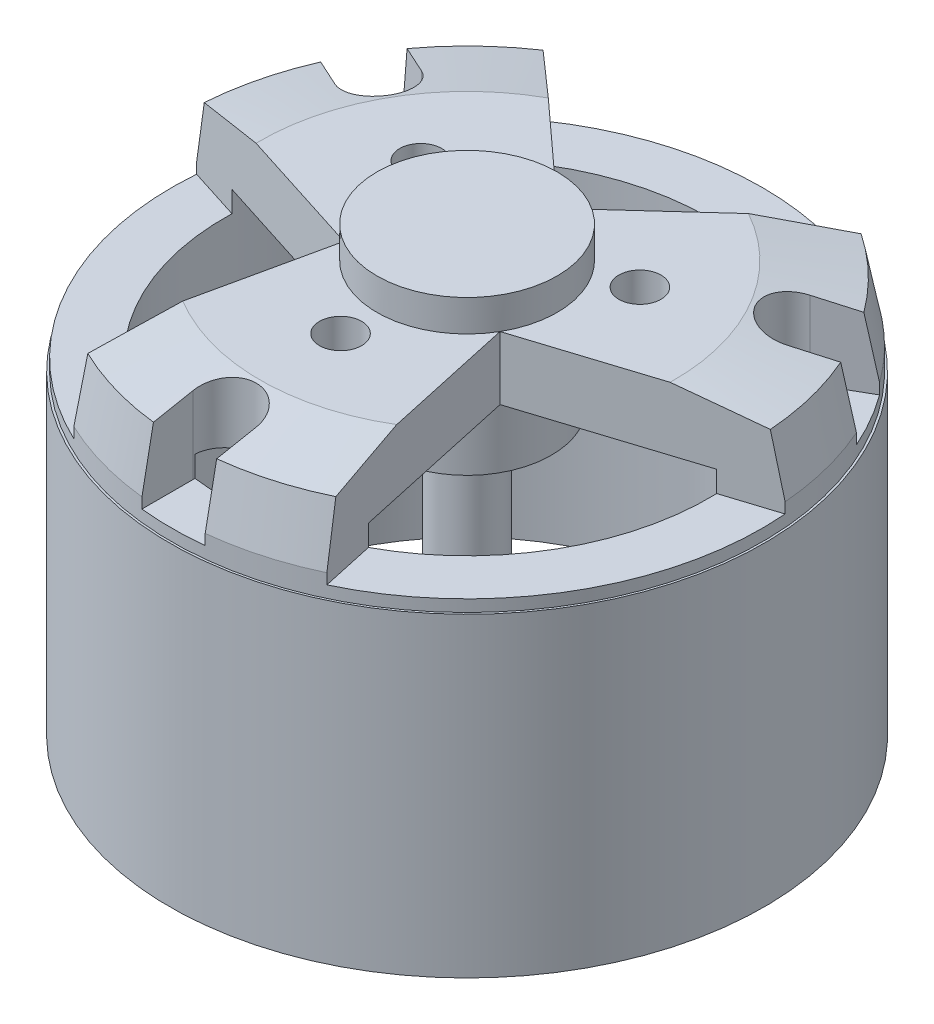
from build123d import *

# Parameters (mm, degrees)
SCHIZZO1_R                   = 14
ESTRUSIONE_ESTRUSIONE1_DEPTH = 19.5
TAGLIO_ESTRUSIONE1_START     = -4
SCHIZZO2_R                   = 1
TAGLIO_ESTRUSIONE1_DEPTH     = 4
SCHIZZO3_R                   = 4.27486225
ESTRUSIONE_ESTRUSIONE2_DEPTH = 1.5
SCHIZZO4_R                   = 11.5
TAGLIO_ESTRUSIONE2_DEPTH     = 16.5
SCHIZZO5_R                   = 1.5
TAGLIO_ESTRUSIONE3_DEPTH     = 16.5
TAGLIO_ESTRUSIONE4_START     = -4
TAGLIO_ESTRUSIONE4_DEPTH     = 4
SCHIZZO7_R                   = 1.5
ESTRUSIONE_ESTRUSIONE3_DEPTH = 27.5
SCHIZZO8_R                   = 4
ESTRUSIONE_ESTRUSIONE4_DEPTH = 3
SCHIZZO9_W                   = 0.1
SCHIZZO9_H                   = 14.938811625
SMUSSO1_SIZE                 = 3.5
SMUSSO1_SIZE2                = 0.680331082
SMUSSO2_SIZE                 = 0.720279458
SMUSSO2_SIZE_2               = 3.5


with BuildPart() as part:
    # Schizzo1 → Estrusione-Estrusione1 (new body)
    with BuildSketch(Plane(origin=(0, 0, 0), x_dir=(1, 0, 0), z_dir=(0, 1, 0))):
        with Locations(Location((0, 0, 0), (0, 0, 270))):
            Circle(SCHIZZO1_R)
    extrude(amount=ESTRUSIONE_ESTRUSIONE1_DEPTH)

    # Schizzo2 → Taglio-Estrusione1 (cut)
    with BuildSketch(Plane(origin=(0, 19.5, 0), x_dir=(1, 0, 0), z_dir=(0, 1, 0)).offset(TAGLIO_ESTRUSIONE1_START)):
        with BuildLine():
            Line((-7.95445115, 11.520707743), (0, 4.27486225))
            Line((0, 4.27486225), (7.95445115, 11.520707743))
            ThreePointArc((7.95445115, 11.520707743), (0, 14), (-7.95445115, 11.520707743))
        make_face()
        with BuildLine():
            ThreePointArc((14, 0), (13.988608153, 0.564660915), (13.95445115, 1.128402898))
            Line((13.95445115, 1.128402898), (3.702139306, -2.137431125))
            Line((3.702139306, -2.137431125), (6, -12.649110641))
            ThreePointArc((6, -12.649110641), (11.832159566, -7.483314774), (14, 0))
        make_face()
        with BuildLine():
            Line((-3.702139306, -2.137431125), (-13.95445115, 1.128402898))
            ThreePointArc((-13.95445115, 1.128402898), (-12.124355653, -7), (-6, -12.649110641))
            Line((-6, -12.649110641), (-3.702139306, -2.137431125))
        make_face()
        with Locations(Location((0, -6, 0), (0, 0, 270))):
            Circle(SCHIZZO2_R)
        with Locations(Location((-5.196152423, 3, 0), (0, 0, 270))):
            Circle(SCHIZZO2_R)
        with Locations(Location((5.196152423, 3, 0), (0, 0, 270))):
            Circle(SCHIZZO2_R)
    extrude(amount=TAGLIO_ESTRUSIONE1_DEPTH, mode=Mode.SUBTRACT)

    # Schizzo3 → Estrusione-Estrusione2 (add)
    with BuildSketch(Plane(origin=(0, 19.5, 0), x_dir=(1, 0, 0), z_dir=(0, 1, 0))):
        with Locations(Location((0, 0, 0), (0, 0, 90))):
            Circle(SCHIZZO3_R)
    extrude(amount=ESTRUSIONE_ESTRUSIONE2_DEPTH)

    # Schizzo4 → Taglio-Estrusione2 (cut)
    with BuildSketch(Plane.XZ):
        with Locations(Location((0, 0, 0), (0, 0, 270))):
            Circle(SCHIZZO4_R)
    extrude(amount=-TAGLIO_ESTRUSIONE2_DEPTH, mode=Mode.SUBTRACT)

    # Schizzo5 → Taglio-Estrusione3 (cut)
    with BuildSketch(Plane(origin=(0, 21, 0), x_dir=(1, 0, 0), z_dir=(0, 1, 0))):
        with Locations(Location((0, 0, 0), (0, 0, 270))):
            Circle(SCHIZZO5_R)
    extrude(amount=-TAGLIO_ESTRUSIONE3_DEPTH, mode=Mode.SUBTRACT)

    # Schizzo6 → Taglio-Estrusione4 (cut)
    with BuildSketch(Plane(origin=(0, 19.5, 0), x_dir=(1, 0, 0), z_dir=(0, 1, 0)).offset(TAGLIO_ESTRUSIONE4_START)):
        with BuildLine():
            Line((1.5, -13.919410907), (1.5, -11.5))
            ThreePointArc((1.5, -11.5), (0, -10), (-1.5, -11.5))
            Line((-1.5, -11.5), (-1.5, -13.919410907))
            ThreePointArc((-1.5, -13.919410907), (0, -14), (1.5, -13.919410907))
        make_face()
        with BuildLine():
            ThreePointArc((9.209292144, 7.049038106), (8.660254038, 5), (10.709292144, 4.450961894))
            Line((10.709292144, 4.450961894), (12.804563451, 5.660667348))
            ThreePointArc((12.804563451, 5.660667348), (12.124355653, 7), (11.304563451, 8.258743559))
            Line((11.304563451, 8.258743559), (9.209292144, 7.049038106))
        make_face()
        with BuildLine():
            ThreePointArc((-10.709292144, 4.450961894), (-8.660254038, 5), (-9.209292144, 7.049038106))
            Line((-9.209292144, 7.049038106), (-11.304563451, 8.258743559))
            ThreePointArc((-11.304563451, 8.258743559), (-12.124355653, 7), (-12.804563451, 5.660667348))
            Line((-12.804563451, 5.660667348), (-10.709292144, 4.450961894))
        make_face()
    extrude(amount=TAGLIO_ESTRUSIONE4_DEPTH, mode=Mode.SUBTRACT)

    # Schizzo7 → Estrusione-Estrusione3 (add)
    with BuildSketch(Plane(origin=(0, 21, 0), x_dir=(1, 0, 0), z_dir=(0, 1, 0))):
        with Locations(Location((0, 0, 0), (0, 0, 270))):
            Circle(SCHIZZO7_R)
    extrude(amount=-ESTRUSIONE_ESTRUSIONE3_DEPTH)

    # Schizzo8 → Estrusione-Estrusione4 (add)
    with BuildSketch(Plane.XZ.offset(-16.5)):
        with Locations(Location((0, 0, 0), (0, 0, 270))):
            Circle(SCHIZZO8_R)
    extrude(amount=ESTRUSIONE_ESTRUSIONE4_DEPTH)

    # Schizzo9 → Rivoluzione1 (revolve)
    with BuildSketch(Plane.XY, mode=Mode.PRIVATE) as rivoluzione1_sk:
        with Locations((-14.05, 7.469405813)):
            Rectangle(SCHIZZO9_W, SCHIZZO9_H)
    revolve(rivoluzione1_sk.sketch.rotate(Axis((0, -6.5, 0), (0, 1, 0)), 270), axis=Axis((0, -6.5, 0), (0, 1, 0)))

    # Smusso1
    smusso1_edges = [part.edges().sort_by_distance(p)[0] for p in [
        (9.766653134, 19.5, -10.030577579),
        (-13.570061565, 19.5, -3.442880935),
        (13.570061565, 19.5, -3.442880935),
        (-3.803408431, 19.5, 13.473458513),
        (-9.766653134, 19.5, -10.030577579),
        (3.803408431, 19.5, 13.473458513),
    ]]
    smusso1_side = [part.faces().sort_by_distance(p)[0] for p in [
        (0, 17.219405813, -14),
    ]]
    chamfer(smusso1_edges, length=SMUSSO1_SIZE, length2=SMUSSO1_SIZE2, reference=smusso1_side[0])

    # Smusso2
    # the kernel refuses this chamfer: 3.5, 0.720279458 mm, written as the material it takes off along each edge
    with BuildSketch(Plane(origin=(0, 19.5, 0), x_dir=(-0.4593857913267627, 0, -0.8882368460760249), z_dir=(0.8882368460760249, 0, -0.4593857913267627))) as smusso2_piece_1:
        Polygon((13.319668918 + SMUSSO2_SIZE * 0.190808995258, -SMUSSO2_SIZE * 0.981627182836), (13.319668918 - SMUSSO2_SIZE_2, 0), (13.319668918, 0), align=None)
    revolve(axis=Axis((0, 19.5, 0), (0, 1, 0)), revolution_arc=97.827137871, mode=Mode.SUBTRACT)
    with BuildSketch(Plane(origin=(0, 19.5, 0), x_dir=(-0.5395427776158211, 0, 0.8419581884646081), z_dir=(-0.8419581884646081, 0, -0.5395427776158211))) as smusso2_piece_2:
        Polygon((13.319668918 + SMUSSO2_SIZE * 0.190808995258, -SMUSSO2_SIZE * 0.981627182836), (13.319668918 - SMUSSO2_SIZE_2, 0), (13.319668918, 0), align=None)
    revolve(axis=Axis((0, 19.5, 0), (0, 1, 0)), revolution_arc=97.827137871, mode=Mode.SUBTRACT)
    with BuildSketch(Plane(origin=(0, 19.5, 0), x_dir=(0.8174001702166583, 0, 0.5760702749923641), z_dir=(-0.5760702749923641, 0, 0.8174001702166583))) as smusso2_piece_3:
        Polygon((13.319668918 + SMUSSO2_SIZE * 0.190808995258, -SMUSSO2_SIZE * 0.981627182836), (13.319668918 - SMUSSO2_SIZE_2, 0), (13.319668918, 0), align=None)
    revolve(axis=Axis((0, 19.5, 0), (0, 1, 0)), revolution_arc=97.827137871, mode=Mode.SUBTRACT)


solid = part.part
